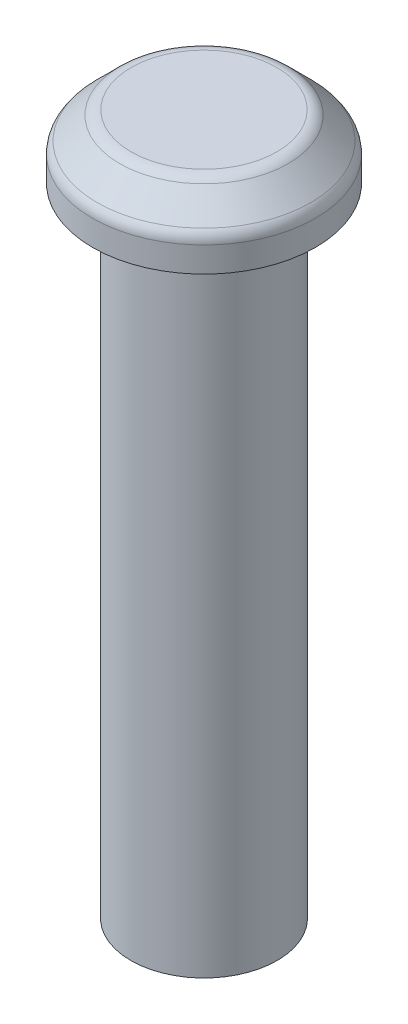
from build123d import *

# Parameters (mm, degrees)
SKETCH1_R           = 2.3
BOSS_EXTRUDE1_DEPTH = 20
SKETCH2_R           = 3.5
BOSS_EXTRUDE2_DEPTH = 2
CHAMFER1_SIZE       = 1
FILLET1_R           = 0.5


with BuildPart() as part:
    # Sketch1 → Boss-Extrude1 (new body)
    with BuildSketch(Plane(origin=(0, 0, 0), x_dir=(1, 0, 0), z_dir=(0, 1, 0))):
        Circle(SKETCH1_R)
    extrude(amount=BOSS_EXTRUDE1_DEPTH)

    # Sketch2 → Boss-Extrude2 (add)
    with BuildSketch(Plane(origin=(0, 20, 0), x_dir=(1, 0, 0), z_dir=(0, 1, 0))):
        Circle(SKETCH2_R)
    extrude(amount=BOSS_EXTRUDE2_DEPTH)

    # Chamfer1
    chamfer1_edges = [part.edges().sort_by_distance(p)[0] for p in [
        (-3.5, 22, 0),
    ]]
    chamfer(chamfer1_edges, length=CHAMFER1_SIZE)

    # Fillet1
    fillet1_edges = [part.edges().sort_by_distance(p)[0] for p in [
        (-3.5, 21, 0),
        (-2.5, 22, 0),
    ]]
    fillet(fillet1_edges, radius=FILLET1_R)


solid = part.part
